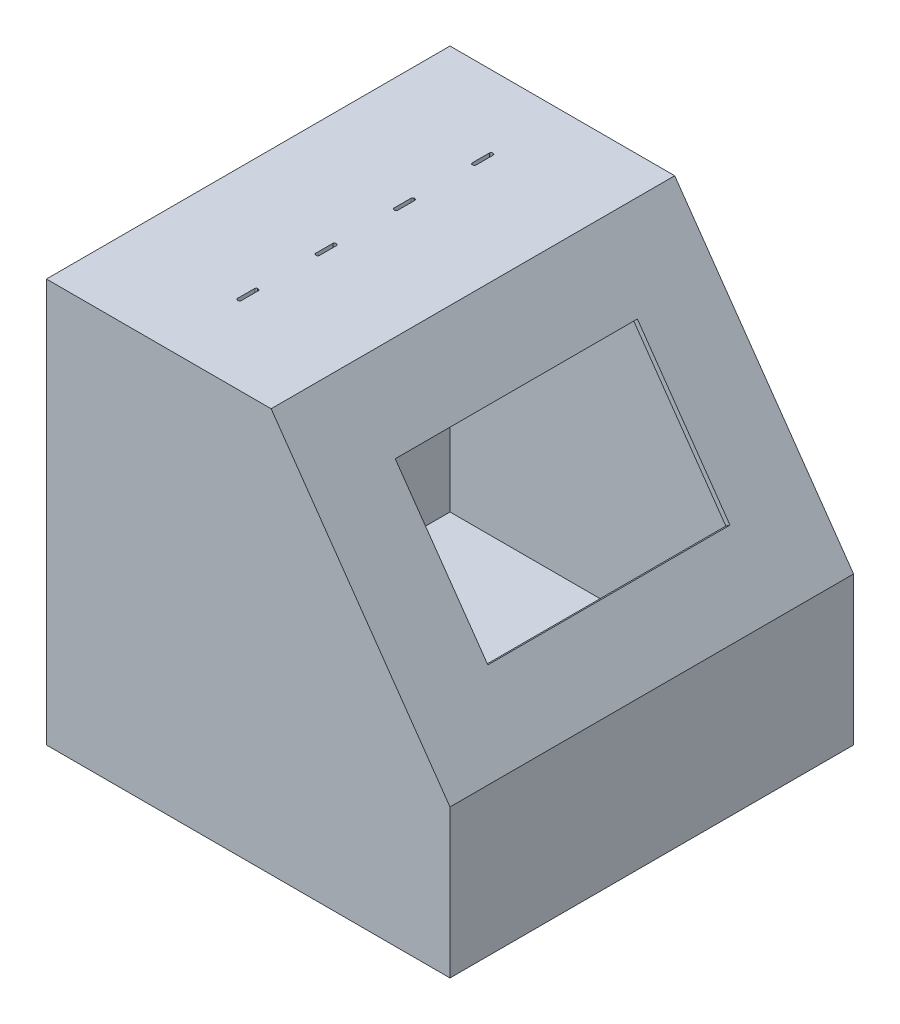
from build123d import *

# Parameters (mm, degrees)
BOSS_EXTRUDE1_DEPTH = 508
SKETCH3_W           = 304.8
SKETCH3_H           = 203.2
CUT_EXTRUDE3_DEPTH  = 6.35
SHELL2_START        = 6.35
SHELL2_DEPTH        = 495.3
CUT_EXTRUDE5_REACH  = 881.882


# Read off the part's stored shape, not the designer's step: Shell2
with BuildPart() as part:
    # Sketch1 → Boss-Extrude1 (new body)
    with BuildSketch(Plane.XY):
        Polygon((0, 101.6), (0, 609.6), (282.846955047, 609.6), (508, 288.048127639), (508, 101.6), align=None)
    extrude(amount=BOSS_EXTRUDE1_DEPTH)

    # Sketch3 → Cut-Extrude3 (cut)
    with BuildSketch(Plane(origin=(-2211.042315979, 4171.242991451, 0), x_dir=(0, 0, -1), z_dir=(-0.8191520442889911, -0.573576436351047, 0))):
        with Locations((-254, 4544.813258204)):
            Rectangle(SKETCH3_W, SKETCH3_H)
    extrude(amount=CUT_EXTRUDE3_DEPTH, mode=Mode.SUBTRACT)

    # Shell2 outline → Shell2 (cut)
    with BuildSketch(Plane.XY.offset(SHELL2_START)):
        Polygon((501.65, 107.95), (501.65, 286.045980329), (279.541354276, 603.25), (6.35, 603.25), (6.35, 107.95), align=None)
    extrude(amount=SHELL2_DEPTH, mode=Mode.SUBTRACT)

    # Sketch10 → Cut-Extrude5 (cut, up to next)
    with BuildSketch(Plane(origin=(0, 609.6, 0), x_dir=(1, 0, 0), z_dir=(0, 1, 0)), mode=Mode.PRIVATE) as cut_extrude5_sk1:
        with BuildLine():
            Line((143.381985017, -385.451435914), (144.181985017, -385.451435914))
            ThreePointArc((144.181985017, -385.451435914), (145.596198579, -386.037222352), (146.181985017, -387.451435914))
            Line((146.181985017, -387.451435914), (146.181985017, -408.951435914))
            ThreePointArc((146.181985017, -408.951435914), (145.596198579, -410.365649476), (144.181985017, -410.951435914))
            Line((144.181985017, -410.951435914), (143.381985017, -410.951435914))
            ThreePointArc((143.381985017, -410.951435914), (141.967771454, -410.365649476), (141.381985017, -408.951435914))
            Line((141.381985017, -408.951435914), (141.381985017, -387.451435914))
            ThreePointArc((141.381985017, -387.451435914), (141.967771454, -386.037222352), (143.381985017, -385.451435914))
        make_face()
    cut_extrude5_tool1 = extrude(cut_extrude5_sk1.sketch, amount=-CUT_EXTRUDE5_REACH, mode=Mode.PRIVATE) & part.part
    # Sketch10 → Cut-Extrude5 (cut, up to next)
    with BuildSketch(Plane(origin=(0, 609.6, 0), x_dir=(1, 0, 0), z_dir=(0, 1, 0)), mode=Mode.PRIVATE) as cut_extrude5_sk2:
        with BuildLine():
            Line((144.181985017, -312.438871317), (143.381985017, -312.438871317))
            ThreePointArc((143.381985017, -312.438871317), (141.967771454, -311.853084879), (141.381985017, -310.438871317))
            Line((141.381985017, -310.438871317), (141.381985017, -288.938871317))
            ThreePointArc((141.381985017, -288.938871317), (141.967771454, -287.524657755), (143.381985017, -286.938871317))
            Line((143.381985017, -286.938871317), (144.181985017, -286.938871317))
            ThreePointArc((144.181985017, -286.938871317), (145.596198579, -287.524657755), (146.181985017, -288.938871317))
            Line((146.181985017, -288.938871317), (146.181985017, -310.438871317))
            ThreePointArc((146.181985017, -310.438871317), (145.596198579, -311.853084879), (144.181985017, -312.438871317))
        make_face()
    cut_extrude5_tool2 = extrude(cut_extrude5_sk2.sketch, amount=-CUT_EXTRUDE5_REACH, mode=Mode.PRIVATE) & part.part
    # Sketch10 → Cut-Extrude5 (cut, up to next)
    with BuildSketch(Plane(origin=(0, 609.6, 0), x_dir=(1, 0, 0), z_dir=(0, 1, 0)), mode=Mode.PRIVATE) as cut_extrude5_sk3:
        with BuildLine():
            Line((144.181985017, -213.92630672), (143.381985017, -213.92630672))
            ThreePointArc((143.381985017, -213.92630672), (141.967771454, -213.340520282), (141.381985017, -211.92630672))
            Line((141.381985017, -211.92630672), (141.381985017, -190.42630672))
            ThreePointArc((141.381985017, -190.42630672), (141.967771454, -189.012093158), (143.381985017, -188.42630672))
            Line((143.381985017, -188.42630672), (144.181985017, -188.42630672))
            ThreePointArc((144.181985017, -188.42630672), (145.596198579, -189.012093158), (146.181985017, -190.42630672))
            Line((146.181985017, -190.42630672), (146.181985017, -211.92630672))
            ThreePointArc((146.181985017, -211.92630672), (145.596198579, -213.340520282), (144.181985017, -213.92630672))
        make_face()
    cut_extrude5_tool3 = extrude(cut_extrude5_sk3.sketch, amount=-CUT_EXTRUDE5_REACH, mode=Mode.PRIVATE) & part.part
    # Sketch10 → Cut-Extrude5 (cut, up to next)
    with BuildSketch(Plane(origin=(0, 609.6, 0), x_dir=(1, 0, 0), z_dir=(0, 1, 0)), mode=Mode.PRIVATE) as cut_extrude5_sk4:
        with BuildLine():
            Line((144.181985017, -115.413742123), (143.381985017, -115.413742123))
            ThreePointArc((143.381985017, -115.413742123), (141.967771454, -114.827955685), (141.381985017, -113.413742123))
            Line((141.381985017, -113.413742123), (141.381985017, -91.913742123))
            ThreePointArc((141.381985017, -91.913742123), (141.967771454, -90.499528561), (143.381985017, -89.913742123))
            Line((143.381985017, -89.913742123), (144.181985017, -89.913742123))
            ThreePointArc((144.181985017, -89.913742123), (145.596198579, -90.499528561), (146.181985017, -91.913742123))
            Line((146.181985017, -91.913742123), (146.181985017, -113.413742123))
            ThreePointArc((146.181985017, -113.413742123), (145.596198579, -114.827955685), (144.181985017, -115.413742123))
        make_face()
    cut_extrude5_tool4 = extrude(cut_extrude5_sk4.sketch, amount=-CUT_EXTRUDE5_REACH, mode=Mode.PRIVATE) & part.part
    add(cut_extrude5_tool1.solids().sort_by_distance((143.781985, 609.6, 398.201436))[0], mode=Mode.SUBTRACT)
    add(cut_extrude5_tool2.solids().sort_by_distance((143.781985, 609.6, 299.688871))[0], mode=Mode.SUBTRACT)
    add(cut_extrude5_tool3.solids().sort_by_distance((143.781985, 609.6, 201.176307))[0], mode=Mode.SUBTRACT)
    add(cut_extrude5_tool4.solids().sort_by_distance((143.781985, 609.6, 102.663742))[0], mode=Mode.SUBTRACT)


solid = part.part
